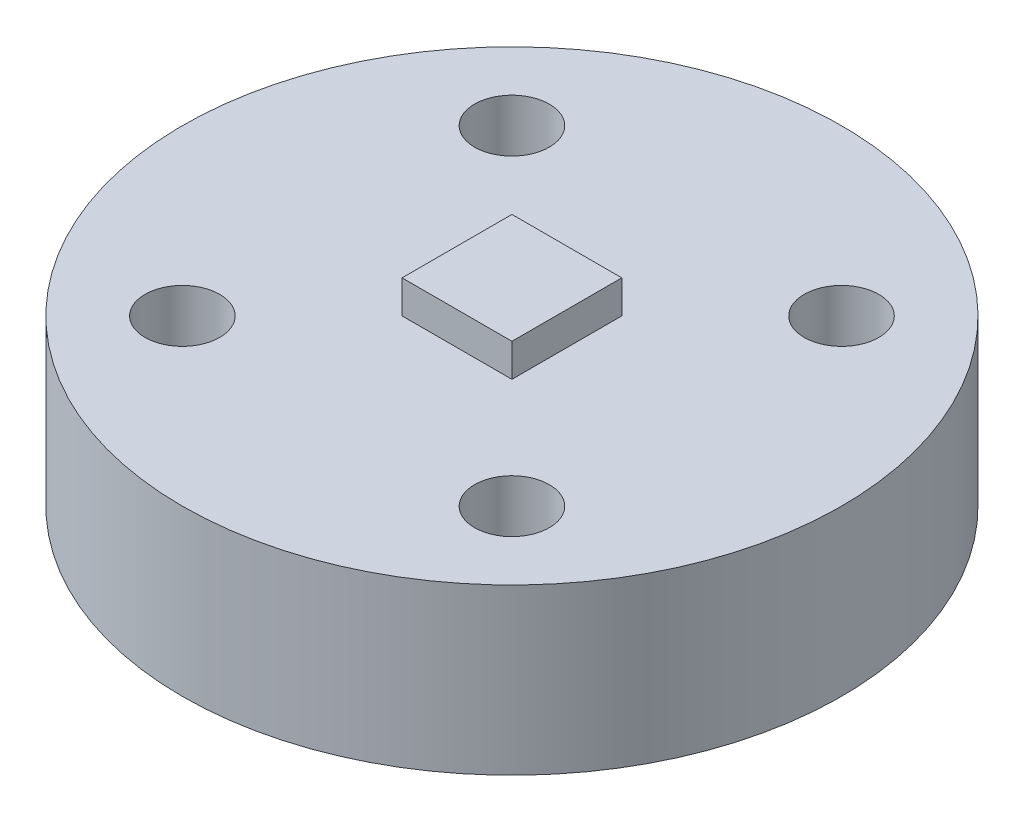
from build123d import *

# Parameters (mm, degrees)
SKETCH1_R           = 30
BOSS_EXTRUDE1_DEPTH = 15
SKETCH2_W           = 10
SKETCH2_H           = 10
BOSS_EXTRUDE2_DEPTH = 3
SKETCH3_W           = 10
SKETCH3_H           = 10
CUT_EXTRUDE1_DEPTH  = 3
SKETCH6_R           = 3.4
CUT_EXTRUDE3_DEPTH  = 10


with BuildPart() as part:
    # Sketch1 → Boss-Extrude1 (new body)
    with BuildSketch(Plane(origin=(0, 0, 0), x_dir=(1, 0, 0), z_dir=(0, 1, 0))):
        Circle(SKETCH1_R)
    extrude(amount=BOSS_EXTRUDE1_DEPTH)

    # Sketch2 → Boss-Extrude2 (add)
    with BuildSketch(Plane(origin=(0, 15, 0), x_dir=(1, 0, 0), z_dir=(0, 1, 0))):
        Rectangle(SKETCH2_W, SKETCH2_H)
    extrude(amount=BOSS_EXTRUDE2_DEPTH)

    # Sketch3 → Cut-Extrude1 (cut)
    with BuildSketch(Plane.XZ):
        Rectangle(SKETCH3_W, SKETCH3_H)
    extrude(amount=-CUT_EXTRUDE1_DEPTH, mode=Mode.SUBTRACT)

    # Sketch6 → Cut-Extrude3 (cut)
    with BuildSketch(Plane(origin=(0, 15, 0), x_dir=(1, 0, 0), z_dir=(0, 1, 0))):
        with Locations((-15, -15)):
            Circle(SKETCH6_R)
        with Locations((15, -15)):
            Circle(SKETCH6_R)
        with Locations((15, 15)):
            Circle(SKETCH6_R)
        with Locations((-15, 15)):
            Circle(SKETCH6_R)
    extrude(amount=-CUT_EXTRUDE3_DEPTH, mode=Mode.SUBTRACT)


solid = part.part
